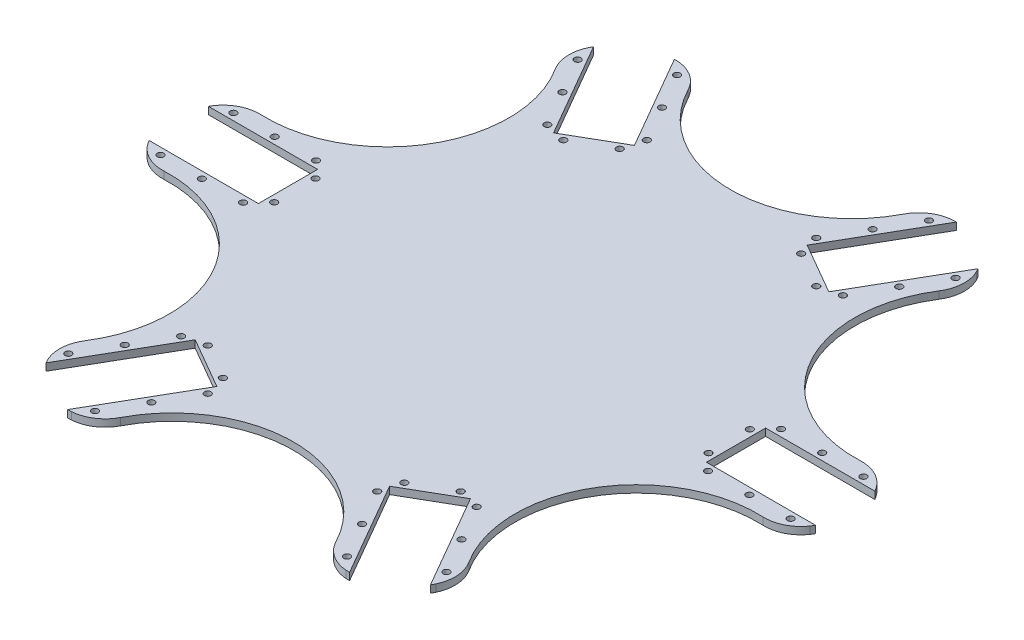
from build123d import *

# Parameters (mm, degrees)
SKETCH2_R           = 1.35
BOSS_EXTRUDE1_DEPTH = 3
CIRPATTERN1_COUNT   = 6
CUT_EXTRUDE3_DEPTH  = 5
CUT_EXTRUDE9_DEPTH  = 10


with BuildPart() as part:
    # Sketch2 → Boss-Extrude1 (new body)
    with BuildSketch(Plane(origin=(0, 0, 0), x_dir=(1, 0, 0), z_dir=(0, 1, 0))):
        Polygon((0, 125), (-58.08143708, 125), (-35.58143708, 86.02885683), (-56.712456933, 73.82885683), (-79.212456933, 112.8), (-108.253175473, 62.5), (0, 0), align=None)
        with Locations((-37.385731074, 81.753985699)):
            Circle(SKETCH2_R, mode=Mode.SUBTRACT)
        with Locations((-52.108162939, 73.253985699)):
            Circle(SKETCH2_R, mode=Mode.SUBTRACT)
        with Locations((-60.887328063, 75.459945743)):
            Circle(SKETCH2_R, mode=Mode.SUBTRACT)
        with Locations((-34.90656595, 90.459945743)):
            Circle(SKETCH2_R, mode=Mode.SUBTRACT)
        with Locations((-51.90656595, 119.904809472)):
            Circle(SKETCH2_R, mode=Mode.SUBTRACT)
        with Locations((-43.40656595, 105.182377607)):
            Circle(SKETCH2_R, mode=Mode.SUBTRACT)
        with Locations((-69.387328063, 90.182377607)):
            Circle(SKETCH2_R, mode=Mode.SUBTRACT)
        with Locations((-77.887328063, 104.904809472)):
            Circle(SKETCH2_R, mode=Mode.SUBTRACT)
    boss_extrude1 = extrude(amount=BOSS_EXTRUDE1_DEPTH)

    # CirPattern1: Boss-Extrude1 ×6 about axis
    cirpattern1_axis = Axis((0, 3, 0), (0, -1, 0))
    for i in range(1, CIRPATTERN1_COUNT):
        add(boss_extrude1.rotate(cirpattern1_axis, i * 360 / CIRPATTERN1_COUNT))

    # Sketch4 → Cut-Extrude3 (cut)
    with BuildSketch(Plane(origin=(0, 3, 0), x_dir=(1, 0, 0), z_dir=(0, 1, 0))):
        with BuildLine():
            Line((79.212456933, -112.8), (137.293894013, -12.2))
            ThreePointArc((137.293894013, -12.2), (125.5592118, -23.716902798), (109.56410095, -27.524558982))
            ThreePointArc((109.56410095, -27.524558982), (77.942286341, -45), (78.619017782, -81.123015275))
            ThreePointArc((78.619017782, -81.123015275), (83.319046223, -96.879015699), (79.212456933, -112.8))
        make_face()
        with BuildLine():
            Line((137.293894013, 12.2), (79.212456933, 112.8))
            ThreePointArc((79.212456933, 112.8), (83.319046223, 96.879015699), (78.619017782, 81.123015275))
            ThreePointArc((78.619017782, 81.123015275), (77.942286341, 45), (109.56410095, 27.524558982))
            ThreePointArc((109.56410095, 27.524558982), (125.5592118, 23.716902798), (137.293894013, 12.2))
        make_face()
        with BuildLine():
            Line((58.08143708, 125), (-58.08143708, 125))
            ThreePointArc((-58.08143708, 125), (-42.240165578, 120.595918497), (-30.945083169, 108.647574257))
            ThreePointArc((-30.945083169, 108.647574257), (0, 90), (30.945083169, 108.647574257))
            ThreePointArc((30.945083169, 108.647574257), (42.240165578, 120.595918497), (58.08143708, 125))
        make_face()
        with BuildLine():
            Line((-79.212456933, 112.8), (-137.293894013, 12.2))
            ThreePointArc((-137.293894013, 12.2), (-125.5592118, 23.716902798), (-109.56410095, 27.524558982))
            ThreePointArc((-109.56410095, 27.524558982), (-77.942286341, 45), (-78.619017782, 81.123015275))
            ThreePointArc((-78.619017782, 81.123015275), (-83.319046223, 96.879015699), (-79.212456933, 112.8))
        make_face()
        with BuildLine():
            Line((-137.293894013, -12.2), (-79.212456933, -112.8))
            ThreePointArc((-79.212456933, -112.8), (-83.319046223, -96.879015699), (-78.619017782, -81.123015275))
            ThreePointArc((-78.619017782, -81.123015275), (-77.942286341, -45), (-109.56410095, -27.524558982))
            ThreePointArc((-109.56410095, -27.524558982), (-125.5592118, -23.716902798), (-137.293894013, -12.2))
        make_face()
        with BuildLine():
            Line((-58.08143708, -125), (58.08143708, -125))
            ThreePointArc((58.08143708, -125), (42.240165578, -120.595918497), (30.945083169, -108.647574257))
            ThreePointArc((30.945083169, -108.647574257), (0, -90), (-30.945083169, -108.647574257))
            ThreePointArc((-30.945083169, -108.647574257), (-42.240165578, -120.595918497), (-58.08143708, -125))
        make_face()
    extrude(amount=-CUT_EXTRUDE3_DEPTH, mode=Mode.SUBTRACT)

    # Sketch9 → Cut-Extrude9 (cut)
    with BuildSketch(Plane(origin=(0, 3, 0), x_dir=(1, 0, 0), z_dir=(0, 1, 0))):
        with BuildLine():
            Line((57.250180902, 125), (-57.250180902, 125))
            ThreePointArc((-57.250180902, 125), (-49.705136426, 122.71904735), (-44.358314608, 116.927507176))
            ThreePointArc((-44.358314608, 116.927507176), (0, 90), (44.358314608, 116.927507176))
            ThreePointArc((44.358314608, 116.927507176), (49.705136426, 122.71904735), (57.250180902, 125))
        make_face()
        with BuildLine():
            Line((136.878265924, 12.919888968), (79.628085022, 112.080111032))
            ThreePointArc((79.628085022, 112.080111032), (81.425244321, 104.405434518), (79.083034312, 96.879180908))
            ThreePointArc((79.083034312, 96.879180908), (77.942286341, 45), (123.44134892, 20.048326268))
            ThreePointArc((123.44134892, 20.048326268), (131.130380747, 18.313612832), (136.878265924, 12.919888968))
        make_face()
        with BuildLine():
            Line((79.628085022, -112.080111032), (136.878265924, -12.919888968))
            ThreePointArc((136.878265924, -12.919888968), (131.130380747, -18.313612832), (123.44134892, -20.048326268))
            ThreePointArc((123.44134892, -20.048326268), (77.942286341, -45), (79.083034312, -96.879180908))
            ThreePointArc((79.083034312, -96.879180908), (81.425244321, -104.405434518), (79.628085022, -112.080111032))
        make_face()
        with BuildLine():
            Line((-57.250180902, -125), (57.250180902, -125))
            ThreePointArc((57.250180902, -125), (49.705136426, -122.71904735), (44.358314608, -116.927507176))
            ThreePointArc((44.358314608, -116.927507176), (0, -90), (-44.358314608, -116.927507176))
            ThreePointArc((-44.358314608, -116.927507176), (-49.705136426, -122.71904735), (-57.250180902, -125))
        make_face()
        with BuildLine():
            Line((-136.878265924, -12.919888968), (-79.628085022, -112.080111032))
            ThreePointArc((-79.628085022, -112.080111032), (-81.425244321, -104.405434518), (-79.083034312, -96.879180908))
            ThreePointArc((-79.083034312, -96.879180908), (-77.942286341, -45), (-123.44134892, -20.048326268))
            ThreePointArc((-123.44134892, -20.048326268), (-131.130380747, -18.313612832), (-136.878265924, -12.919888968))
        make_face()
        with BuildLine():
            Line((-79.628085022, 112.080111032), (-136.878265924, 12.919888968))
            ThreePointArc((-136.878265924, 12.919888968), (-131.130380747, 18.313612832), (-123.44134892, 20.048326268))
            ThreePointArc((-123.44134892, 20.048326268), (-77.942286341, 45), (-79.083034312, 96.879180908))
            ThreePointArc((-79.083034312, 96.879180908), (-81.425244321, 104.405434518), (-79.628085022, 112.080111032))
        make_face()
    extrude(amount=-CUT_EXTRUDE9_DEPTH, mode=Mode.SUBTRACT)


solid = part.part
